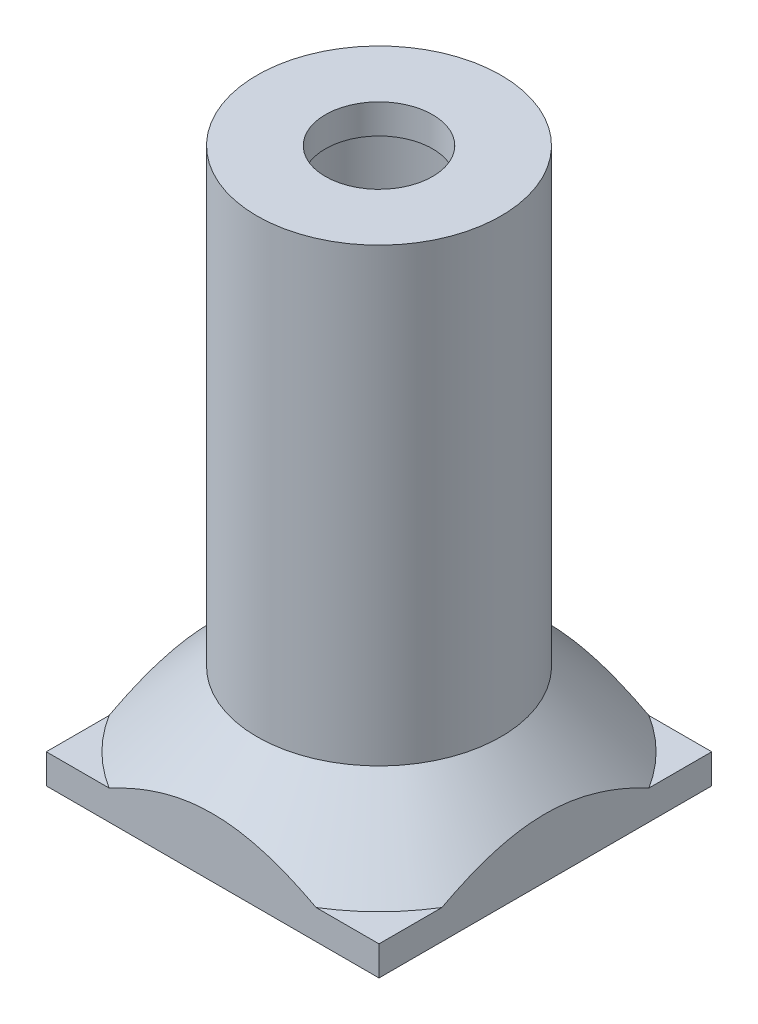
from build123d import *

# Parameters (mm, degrees)
SKETCH2_R           = 16.5
SKETCH2_R_2         = 12.5
SKETCH2_R_3         = 7.25
BOSS_EXTRUDE1_DEPTH = 4
BOSS_EXTRUDE3_START = -67
SKETCH2_4_R         = 16.5
SKETCH2_4_R_2       = 12.5
BOSS_EXTRUDE3_DEPTH = 67
SKETCH3_W           = 45
SKETCH3_H           = 45
BOSS_EXTRUDE4_DEPTH = 4
CHAMFER1_SIZE       = 10


with BuildPart() as part:
    # Sketch2 → Boss-Extrude1 (new body)
    # profile 1 of 2: a face of its own
    with BuildSketch(Plane(origin=(0, 0, 0), x_dir=(1, 0, 0), z_dir=(0, 1, 0))):
        with Locations(Location((0, 0, 0), (0, 0, 270))):
            Circle(SKETCH2_R)
        Circle(SKETCH2_R_2, mode=Mode.SUBTRACT)
    # profile 2 of 2: a face of its own
    with BuildSketch(Plane(origin=(0, 0, 0), x_dir=(1, 0, 0), z_dir=(0, 1, 0))):
        Circle(SKETCH2_R_2)
        with Locations(Location((0, 0, 0), (0, 0, 270))):
            Circle(SKETCH2_R_3, mode=Mode.SUBTRACT)
    extrude(amount=BOSS_EXTRUDE1_DEPTH)

    # Sketch2<4> → Boss-Extrude3 (add)
    with BuildSketch(Plane(origin=(0, 0, 0), x_dir=(1, 0, 0), z_dir=(0, 1, 0)).offset(BOSS_EXTRUDE3_START)):
        with Locations(Location((0, 0, 0), (0, 0, 270))):
            Circle(SKETCH2_4_R)
        with Locations(Location((0, 0, 0), (0, 0, 270))):
            Circle(SKETCH2_4_R_2, mode=Mode.SUBTRACT)
    extrude(amount=BOSS_EXTRUDE3_DEPTH)

    # Sketch3 → Boss-Extrude4 (add)
    with BuildSketch(Plane(origin=(0, -67, 0), x_dir=(-1, 0, 0), z_dir=(0, -1, 0))):
        Rectangle(SKETCH3_W, SKETCH3_H)
    extrude(amount=BOSS_EXTRUDE4_DEPTH)

    # Chamfer1
    # the kernel refuses this chamfer: 10 mm, written as the material it adds along each edge
    with BuildSketch(Plane(origin=(0, -67, 0), x_dir=(0, 0, 1), z_dir=(-1, 0, 0))) as chamfer1_piece_1_section:
        Polygon((16.5 + CHAMFER1_SIZE, 0), (16.5, CHAMFER1_SIZE), (16.5, 0), align=None)
    chamfer1_piece_1 = revolve(axis=Axis((0, -67, 0), (0, 1, 0)), mode=Mode.PRIVATE)
    chamfer1_piece_1 = split(chamfer1_piece_1, bisect_by=Plane(origin=(0, -62.130236746, -22.5), z_dir=(0, 0, 1)), keep=Keep.TOP, mode=Mode.PRIVATE)
    chamfer1_piece_1 = split(chamfer1_piece_1, bisect_by=Plane(origin=(22.5, -62.130236746, -21.369763254), z_dir=(-1, 0, 0)), keep=Keep.TOP, mode=Mode.PRIVATE)
    chamfer1_piece_1 = split(chamfer1_piece_1, bisect_by=Plane(origin=(-22.5, -62.130236746, -21.369763254), z_dir=(1, 0, 0)), keep=Keep.TOP, mode=Mode.PRIVATE)
    chamfer1_piece_1 = split(chamfer1_piece_1, bisect_by=Plane(origin=(0, -62.130236746, 22.5), z_dir=(0, 0, -1)), keep=Keep.TOP, mode=Mode.PRIVATE)
    add(chamfer1_piece_1)


solid = part.part
